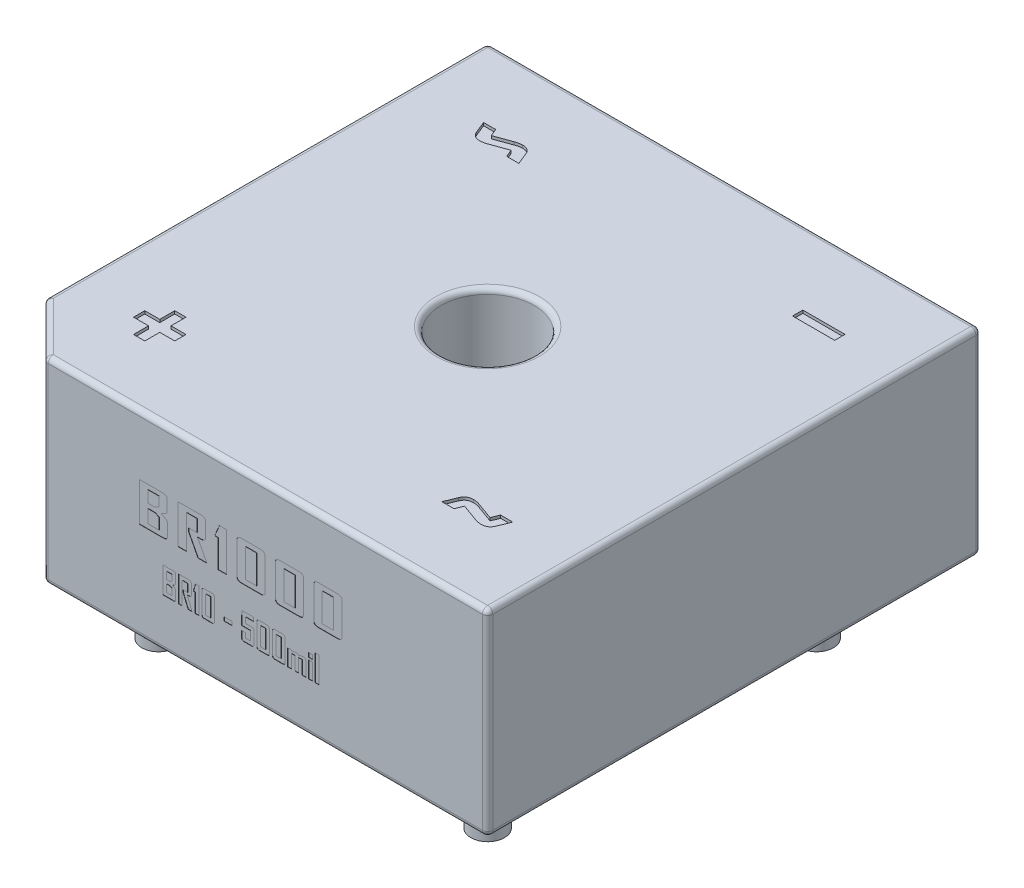
from build123d import *

# Parameters (mm, degrees)
BODY_SKETCH_W          = 19.05
BODY_SKETCH_H          = 19.05
BODY_SKETCH_R          = 1.8
BODY_MAIN_DEPTH        = 7.62
BODY_CHAMFER_SIZE      = 2
SKETCH24_R             = 2.3
BODY_CUT_DEPTH         = 2
BODY_REVOLVE_CUT_REACH = 28.589
BODY_FILLET_R          = 0.2
PIN_B1_SKETCH_R        = 0.65
CIRPATTERN1_COUNT      = 4
TEXT_START             = 3.165
TEXT_2_OUTLINE_W       = 0.43373494
TEXT_2_OUTLINE_H       = 1.102409638
TEXT_2_OUTLINE_W_2     = 0.192771084
TEXT_2_OUTLINE_H_2     = 0.710843374
TEXT_2_OUTLINE_W_3     = 0.144578313
TEXT_2_OUTLINE_H_3     = 1
TEXT_2_OUTLINE_W_4     = 0.144578314
TEXT_2_OUTLINE_H_4     = 0.638554217
TEXT_2_OUTLINE_W_5     = 0.30120482
TEXT_2_OUTLINE_H_5     = 0.144578314
TEXT_2_OUTLINE_W_6     = 0.147213856
TEXT_2_OUTLINE_H_6     = 0.156626506
TEXT_2_DEPTH           = 0.01
SKETCH23_W             = 1.626506024
SKETCH23_H             = 0.397590362
TEXT1_DEPTH            = 0.11
PIN1_MARK_DEPTH        = 0.04


# Read off the part's stored shape, not the designer's step: text
with BuildPart() as part:
    # BODY_Sketch → BODY_MAIN (new body)
    with BuildSketch(Plane(origin=(0, 0.1, 0), x_dir=(1, 0, 0), z_dir=(0, 1, 0))):
        with Locations((6.35, 6.35)):
            Rectangle(BODY_SKETCH_W, BODY_SKETCH_H)
        with Locations(Location((6.35, 6.35, 0), (0, 0, 270))):
            Circle(BODY_SKETCH_R, mode=Mode.SUBTRACT)
    extrude(amount=BODY_MAIN_DEPTH)

    # BODY_Chamfer
    body_chamfer_edges = [part.edges().sort_by_distance(p)[0] for p in [
        (-3.175, 3.91, 3.175),
    ]]
    chamfer(body_chamfer_edges, length=BODY_CHAMFER_SIZE)

    # Sketch24 → BODY_Cut (cut)
    with BuildSketch(Plane(origin=(0, 0.1, 0), x_dir=(1, 0, 0), z_dir=(0, 1, 0))):
        Polygon((-0.760786438, -2.175), (14.875, -2.175), (14.875, 14.875), (-2.175, 14.875), (-2.175, -0.760786438), align=None)
        with Locations(Location((6.35, 6.35, 0), (0, 0, 270))):
            Circle(SKETCH24_R, mode=Mode.SUBTRACT)
    extrude(amount=BODY_CUT_DEPTH, mode=Mode.SUBTRACT)

    # Sketch26 → BODY_Revolve (revolve)
    with BuildSketch(Plane(origin=(0, 0, 0), x_dir=(0, -1, 0), z_dir=(0.7071067811865459, 0, 0.7071067811865493)), mode=Mode.PRIVATE) as body_revolve_sk:
        with BuildLine():
            Line((-0.4, 21.03642674), (-2.3, 21.03642674))
            Line((-2.3, 21.03642674), (-2.3, 11.280256121))
            Line((-2.3, 11.280256121), (-0.4, 11.280256121))
            add(Edge.make_bspline(
                [(-0.4, 21.03642674), (-0.4, 19.889627326), (-0.209776082, 15.127894517), (-3.178684892, 11.698140496), (-0.4, 11.280256121)],
                knots=[0, 0, 0, 0, 0.561002495, 1, 1, 1, 1], degree=3))
        make_face()
    revolve(body_revolve_sk.sketch.rotate(Axis((6.35, 11.869169558, -6.35), (0, -1, 0)), 135), axis=Axis((6.35, 11.869169558, -6.35), (0, -1, 0)))

    # Sketch28 → BODY_Revolve_Cut (cut, up to next)
    with BuildSketch(Plane(origin=(0, 2.3, 0), x_dir=(1, 0, 0), z_dir=(0, 1, 0)), mode=Mode.PRIVATE) as body_revolve_cut_sk1:
        with BuildLine():
            Line((-3.175, -1.040915031), (-3.175, 13.740915031))
            ThreePointArc((-3.175, 13.740915031), (-5.706170619, 6.35), (-3.175, -1.040915031))
        make_face()
    body_revolve_cut_tool1 = extrude(body_revolve_cut_sk1.sketch, amount=-BODY_REVOLVE_CUT_REACH, mode=Mode.PRIVATE) & part.part
    # Sketch28 → BODY_Revolve_Cut (cut, up to next)
    with BuildSketch(Plane(origin=(0, 2.3, 0), x_dir=(1, 0, 0), z_dir=(0, 1, 0)), mode=Mode.PRIVATE) as body_revolve_cut_sk2:
        with BuildLine():
            Line((15.875, 13.740915031), (15.875, -1.040915031))
            ThreePointArc((15.875, -1.040915031), (18.406170619, 6.35), (15.875, 13.740915031))
        make_face()
    body_revolve_cut_tool2 = extrude(body_revolve_cut_sk2.sketch, amount=-BODY_REVOLVE_CUT_REACH, mode=Mode.PRIVATE) & part.part
    # Sketch28 → BODY_Revolve_Cut (cut, up to next)
    with BuildSketch(Plane(origin=(0, 2.3, 0), x_dir=(1, 0, 0), z_dir=(0, 1, 0)), mode=Mode.PRIVATE) as body_revolve_cut_sk3:
        with BuildLine():
            Line((13.740915031, -3.175), (-1.040915031, -3.175))
            ThreePointArc((-1.040915031, -3.175), (6.35, -5.706170619), (13.740915031, -3.175))
        make_face()
    body_revolve_cut_tool3 = extrude(body_revolve_cut_sk3.sketch, amount=-BODY_REVOLVE_CUT_REACH, mode=Mode.PRIVATE) & part.part
    # Sketch28 → BODY_Revolve_Cut (cut, up to next)
    with BuildSketch(Plane(origin=(0, 2.3, 0), x_dir=(1, 0, 0), z_dir=(0, 1, 0)), mode=Mode.PRIVATE) as body_revolve_cut_sk4:
        with BuildLine():
            ThreePointArc((13.740915031, 15.875), (6.35, 18.406170619), (-1.040915031, 15.875))
            Line((-1.040915031, 15.875), (13.740915031, 15.875))
        make_face()
    body_revolve_cut_tool4 = extrude(body_revolve_cut_sk4.sketch, amount=-BODY_REVOLVE_CUT_REACH, mode=Mode.PRIVATE) & part.part
    add(body_revolve_cut_tool1.solids().sort_by_distance((-4.19717, 2.3, -6.35))[0], mode=Mode.SUBTRACT)
    add(body_revolve_cut_tool2.solids().sort_by_distance((16.89717, 2.3, -6.35))[0], mode=Mode.SUBTRACT)
    add(body_revolve_cut_tool3.solids().sort_by_distance((6.35, 2.3, 4.19717))[0], mode=Mode.SUBTRACT)
    add(body_revolve_cut_tool4.solids().sort_by_distance((6.35, 2.3, -16.89717))[0], mode=Mode.SUBTRACT)

    # BODY_Fillet
    body_fillet_edges = [part.edges().sort_by_distance(p)[0] for p in [
        (6.35, 7.72, -8.15),
        (15.875, 7.72, -6.35),
        (6.35, 7.72, -15.875),
        (7.35, 0.1, 3.175),
        (7.35, 7.72, 3.175),
        (-1.175, 3.91, 3.175),
        (-2.175, 0.1, 2.175),
        (-3.175, 3.91, 1.175),
        (-2.175, 7.72, 2.175),
        (-3.175, 7.72, -7.35),
        (6.35, 0.1, -15.875),
        (15.875, 0.1, -6.35),
        (-3.175, 0.1, -7.35),
        (-3.175, 3.91, -15.875),
        (15.875, 3.91, -15.875),
        (15.875, 3.91, 3.175),
    ]]
    fillet(body_fillet_edges, radius=BODY_FILLET_R)

    # PIN_Sweep: sweep along a path in PIN_B1_Path
    with BuildLine(Plane(origin=(0, 0, 0), x_dir=(0, 0, -1), z_dir=(1, 0, 0))) as pin_sweep_path:
        Line((0, -2.7), (0, 0))
        Line((0, 0), (0, 3.91))
    # PIN_B1_Sketch → PIN_Sweep (sweep)
    with BuildSketch(Plane(origin=(0, 0, 0), x_dir=(1, 0, 0), z_dir=(0, 1, 0))):
        Circle(PIN_B1_SKETCH_R)
    pin_sweep = sweep(path=pin_sweep_path.line)

    # CirPattern1: PIN_Sweep ×4 about axis
    cirpattern1_axis = Axis((6.35, 0, -6.35), (0, 1, 0))
    for i in range(1, CIRPATTERN1_COUNT):
        add(pin_sweep.rotate(cirpattern1_axis, i * 360 / CIRPATTERN1_COUNT))

    # text 2 outline → text 2 (cut)
    # profile 1 of 18: a face of its own
    with BuildSketch(Plane.XY.offset(TEXT_START)):
        with BuildLine():
            add(Edge.make_bspline(
                [(3.517168675, 4.028317018), (3.516403883, 4.019278365), (3.514937013, 4.001942231), (3.505322383, 3.977990262), (3.491015138, 3.957239819), (3.470614139, 3.940744985), (3.445590839, 3.927265222), (3.415160578, 3.91805875), (3.379796517, 3.911839387), (3.354454307, 3.910639002), (3.340963855, 3.91)],
                knots=[0, 0, 0, 0, 0.114098337, 0.218840581, 0.322174175, 0.429434412, 0.547100708, 0.679564678, 0.829422238, 1, 1, 1, 1], degree=3))
            Line((3.517168675, 4.028317018), (3.517168675, 4.465440512))
            add(Edge.make_bspline(
                [(3.442338102, 4.602394578), (3.448288657, 4.598208998), (3.459964348, 4.589996395), (3.475118385, 4.575533806), (3.488123987, 4.560008652), (3.498818426, 4.543448906), (3.507290136, 4.525645952), (3.512674186, 4.50652504), (3.516661579, 4.486406256), (3.516997419, 4.472521049), (3.517168675, 4.465440512)],
                knots=[0, 0, 0, 0, 0.133657493, 0.26225178, 0.383948145, 0.505447312, 0.623949121, 0.745003415, 0.869968602, 1, 1, 1, 1], degree=3))
            add(Edge.make_bspline(
                [(3.267262801, 4.687108434), (3.280257347, 4.681000971), (3.304568919, 4.669574485), (3.338522228, 4.653423057), (3.367595791, 4.639562103), (3.391962136, 4.628060985), (3.411403236, 4.618458496), (3.426052825, 4.611058465), (3.435979806, 4.606218917), (3.440746737, 4.603351741), (3.442338102, 4.602394578)],
                knots=[0, 0, 0, 0, 0.221438922, 0.414291367, 0.579869792, 0.718174277, 0.829838972, 0.91423528, 0.971368777, 1, 1, 1, 1], degree=3))
            add(Edge.make_bspline(
                [(3.436408133, 4.768433735), (3.434816301, 4.767477586), (3.430228435, 4.764721841), (3.420754722, 4.76001016), (3.406502054, 4.753328397), (3.387880519, 4.743865854), (3.364120956, 4.73304747), (3.336126554, 4.719368019), (3.303271363, 4.70384559), (3.27978812, 4.692930333), (3.267262801, 4.687108434)],
                knots=[0, 0, 0, 0, 0.029670315, 0.085513729, 0.168947239, 0.28130074, 0.41925825, 0.586125272, 0.779250554, 1, 1, 1, 1], degree=3))
            add(Edge.make_bspline(
                [(3.505873494, 4.899175452), (3.505637137, 4.892295185), (3.505178082, 4.878932312), (3.502167335, 4.8594097), (3.496354084, 4.841271222), (3.488717573, 4.82419458), (3.479041006, 4.808185101), (3.467113672, 4.793429042), (3.452811598, 4.779996723), (3.441967817, 4.77235282), (3.436408133, 4.768433735)],
                knots=[0, 0, 0, 0, 0.133406508, 0.259102454, 0.381455931, 0.501515548, 0.621060989, 0.743032877, 0.868251092, 1, 1, 1, 1], degree=3))
            Line((3.505873494, 4.899175452), (3.505873494, 5.291682982))
            add(Edge.make_bspline(
                [(3.335316265, 5.41), (3.348337796, 5.409360983), (3.372841008, 5.408158516), (3.407069601, 5.40190675), (3.436604499, 5.392759111), (3.460808674, 5.379164858), (3.480630869, 5.36273941), (3.494300253, 5.341895781), (3.503587924, 5.318010235), (3.505089223, 5.300716923), (3.505873494, 5.291682982)],
                knots=[0, 0, 0, 0, 0.168128508, 0.316375143, 0.448176834, 0.565139626, 0.672821552, 0.776962353, 0.883486227, 1, 1, 1, 1], degree=3))
            Line((3.335316265, 5.41), (2.432831325, 5.41))
            Line((2.432831325, 5.41), (2.432831325, 3.91))
            Line((2.432831325, 3.91), (3.340963855, 3.91))
        make_face()
        Polygon((2.75813253, 4.090722892), (2.75813253, 4.596746988), (3.025828313, 4.596746988), (3.19186747, 4.523045934), (3.19186747, 4.090722892), align=None, mode=Mode.SUBTRACT)
        Polygon((3.180572289, 4.856253765), (3.020180723, 4.77746988), (2.75813253, 4.77746988), (2.75813253, 5.229277108), (3.180572289, 5.229277108), align=None, mode=Mode.SUBTRACT)
    # profile 2 of 18: a face of its own
    with BuildSketch(Plane.XY.offset(TEXT_START)):
        with BuildLine():
            add(Edge.make_bspline(
                [(10.249096386, 4.028317018), (10.248331594, 4.019278365), (10.246864724, 4.001942231), (10.237250094, 3.977990262), (10.222942849, 3.957239819), (10.20254185, 3.940744985), (10.17751855, 3.927265222), (10.147088289, 3.91805875), (10.111724227, 3.911839387), (10.086382018, 3.910639002), (10.072891566, 3.91)],
                knots=[0, 0, 0, 0, 0.114098337, 0.218840581, 0.322174175, 0.429434412, 0.547100708, 0.679564678, 0.829422238, 1, 1, 1, 1], degree=3))
            Line((10.249096386, 4.028317018), (10.249096386, 5.291682982))
            add(Edge.make_bspline(
                [(10.072891566, 5.41), (10.086382018, 5.409360998), (10.111724227, 5.408160613), (10.147088289, 5.40194125), (10.17751855, 5.392734778), (10.20254185, 5.379255015), (10.222942849, 5.362760181), (10.237250094, 5.342009738), (10.246864724, 5.318057769), (10.248331594, 5.300721635), (10.249096386, 5.291682982)],
                knots=[0, 0, 0, 0, 0.170577762, 0.320435322, 0.452899292, 0.570565588, 0.677825825, 0.781159419, 0.885901663, 1, 1, 1, 1], degree=3))
            Line((10.072891566, 5.41), (9.345199548, 5.41))
            add(Edge.make_bspline(
                [(9.164759036, 5.291682982), (9.165498227, 5.300731136), (9.166918835, 5.318120262), (9.176927814, 5.342024646), (9.191505894, 5.362874026), (9.212496005, 5.379244688), (9.238049779, 5.392729829), (9.269212496, 5.402009226), (9.305437795, 5.408121642), (9.331429188, 5.409349484), (9.345199548, 5.41)],
                knots=[0, 0, 0, 0, 0.112348161, 0.215915455, 0.318343111, 0.425762474, 0.543690884, 0.676356302, 0.828532073, 1, 1, 1, 1], degree=3))
            Line((9.164759036, 5.291682982), (9.164759036, 4.028317018))
            add(Edge.make_bspline(
                [(9.340963855, 3.91), (9.327473403, 3.910639002), (9.302131194, 3.911839387), (9.266767132, 3.91805875), (9.236336872, 3.927265222), (9.211313572, 3.940744985), (9.190912573, 3.957239819), (9.176605328, 3.977990262), (9.166990697, 4.001942231), (9.165523828, 4.019278365), (9.164759036, 4.028317018)],
                knots=[0, 0, 0, 0, 0.170577762, 0.320435322, 0.452899292, 0.570565588, 0.677825825, 0.781159419, 0.885901663, 1, 1, 1, 1], degree=3))
            Line((9.340963855, 3.91), (10.072891566, 3.91))
        make_face()
        with Locations((9.706927711, 4.66)):
            Rectangle(TEXT_2_OUTLINE_W, TEXT_2_OUTLINE_H, mode=Mode.SUBTRACT)
    # profile 3 of 18: a face of its own
    with BuildSketch(Plane.XY.offset(TEXT_START)):
        with BuildLine():
            add(Edge.make_bspline(
                [(3.831927711, 2.083878012), (3.831502413, 2.077885605), (3.830699122, 2.066567306), (3.826436952, 2.050788213), (3.820183026, 2.037065602), (3.810963007, 2.025964704), (3.799862109, 2.016744684), (3.786139498, 2.010490759), (3.770360405, 2.006228589), (3.759042106, 2.005425298), (3.753049699, 2.005)],
                knots=[0, 0, 0, 0, 0.143087679, 0.270260174, 0.38817721, 0.5, 0.61182279, 0.729739826, 0.856912321, 1, 1, 1, 1], degree=3))
            Line((3.831927711, 2.083878012), (3.831927711, 2.363245482))
            add(Edge.make_bspline(
                [(3.798606928, 2.454548193), (3.803722035, 2.448658419), (3.814045936, 2.436770995), (3.824563304, 2.414859827), (3.830902474, 2.390022305), (3.831575327, 2.372448922), (3.831927711, 2.363245482)],
                knots=[0, 0, 0, 0, 0.233880582, 0.472044868, 0.723502121, 1, 1, 1, 1], degree=3))
            add(Edge.make_bspline(
                [(3.721046687, 2.511024096), (3.726822169, 2.50694868), (3.737633999, 2.49931941), (3.752708036, 2.488607842), (3.765520512, 2.47931161), (3.776323576, 2.471631347), (3.784931784, 2.465219876), (3.791480129, 2.460361372), (3.795900034, 2.457070977), (3.797924165, 2.455184517), (3.798606928, 2.454548193)],
                knots=[0, 0, 0, 0, 0.220969595, 0.413659948, 0.578075155, 0.71580951, 0.828017936, 0.913546243, 0.970838158, 1, 1, 1, 1], degree=3))
            add(Edge.make_bspline(
                [(3.796159639, 2.565240964), (3.795480129, 2.564600396), (3.793493315, 2.562727444), (3.789106795, 2.559745561), (3.782810736, 2.555140383), (3.77467384, 2.548824153), (3.763952872, 2.541718835), (3.751659749, 2.532448222), (3.736965803, 2.522283934), (3.726561506, 2.514924814), (3.721046687, 2.511024096)],
                knots=[0, 0, 0, 0, 0.030202642, 0.08830924, 0.171209504, 0.28295023, 0.421594497, 0.587395026, 0.781297856, 1, 1, 1, 1], degree=3))
            add(Edge.make_bspline(
                [(3.82684488, 2.652402108), (3.826552541, 2.643510421), (3.825995862, 2.626578628), (3.819928261, 2.602821691), (3.810603299, 2.581824722), (3.800907891, 2.570692759), (3.796159639, 2.565240964)],
                knots=[0, 0, 0, 0, 0.28088772, 0.534874023, 0.772208062, 1, 1, 1, 1], degree=3))
            Line((3.82684488, 2.652402108), (3.82684488, 2.926121988))
            add(Edge.make_bspline(
                [(3.750414157, 3.005), (3.75621656, 3.004567036), (3.767221199, 3.00374589), (3.782539409, 2.999560369), (3.79577047, 2.993184364), (3.806493552, 2.984033749), (3.815234626, 2.972804639), (3.821615553, 2.959257878), (3.82554281, 2.943394033), (3.82639373, 2.932106512), (3.82684488, 2.926121988)],
                knots=[0, 0, 0, 0, 0.140866031, 0.267161677, 0.382887924, 0.494174249, 0.60591769, 0.725745796, 0.854593311, 1, 1, 1, 1], degree=3))
            Line((3.750414157, 3.005), (3.337951807, 3.005))
            Line((3.337951807, 3.005), (3.337951807, 2.005))
            Line((3.337951807, 2.005), (3.753049699, 2.005))
        make_face()
        Polygon((3.48253012, 2.149578313), (3.48253012, 2.43873494), (3.612989458, 2.43873494), (3.687349398, 2.396566265), (3.687349398, 2.149578313), align=None, mode=Mode.SUBTRACT)
        Polygon((3.682266566, 2.631694277), (3.610542169, 2.583313253), (3.48253012, 2.583313253), (3.48253012, 2.860421687), (3.682266566, 2.860421687), align=None, mode=Mode.SUBTRACT)
    # profile 4 of 18: a face of its own
    with BuildSketch(Plane.XY.offset(TEXT_START)):
        with BuildLine():
            add(Edge.make_bspline(
                [(4.355459337, 3.005), (4.361636497, 3.004568328), (4.373319355, 3.003751906), (4.389573015, 2.999586876), (4.403555801, 2.993236219), (4.414878141, 2.984157024), (4.423880575, 2.972893549), (4.430063462, 2.959253025), (4.433611412, 2.943368198), (4.434085605, 2.932102717), (4.434337349, 2.926121988)],
                knots=[0, 0, 0, 0, 0.14634727, 0.276786508, 0.395078095, 0.5071419, 0.617118303, 0.733434305, 0.858482998, 1, 1, 1, 1], degree=3))
            Line((4.355459337, 3.005), (3.940361446, 3.005))
            Line((3.940361446, 3.005), (3.940361446, 2.005))
            Line((3.940361446, 2.005), (4.084939759, 2.005))
            Line((4.084939759, 2.005), (4.084939759, 2.860421687))
            Line((4.084939759, 2.860421687), (4.289759036, 2.860421687))
            Line((4.289759036, 2.860421687), (4.289759036, 2.559216867))
            Line((4.289759036, 2.559216867), (4.121084337, 2.559216867))
            Line((4.121084337, 2.559216867), (4.121084337, 2.469231928))
            Line((4.121084337, 2.469231928), (4.313855422, 2.005))
            Line((4.313855422, 2.005), (4.458433735, 2.005))
            Line((4.458433735, 2.005), (4.285052711, 2.462831325))
            add(Edge.make_bspline(
                [(4.388591867, 2.471114458), (4.386278417, 2.470452137), (4.381135762, 2.468979838), (4.372434165, 2.467399801), (4.362024157, 2.465831183), (4.349882573, 2.464849741), (4.33608352, 2.463823455), (4.320571778, 2.463361137), (4.303378042, 2.462964225), (4.291328141, 2.462876836), (4.285052711, 2.462831325)],
                knots=[0, 0, 0, 0, 0.069269872, 0.153982571, 0.254430838, 0.37240564, 0.504648634, 0.652947489, 0.819259615, 1, 1, 1, 1], degree=3))
            add(Edge.make_bspline(
                [(4.434337349, 2.541709337), (4.434188688, 2.537559037), (4.433902878, 2.529579879), (4.431831943, 2.518089461), (4.428246924, 2.507594265), (4.423135279, 2.498131654), (4.416602648, 2.489656203), (4.408632152, 2.482313383), (4.399230559, 2.47596746), (4.392222513, 2.472770633), (4.388591867, 2.471114458)],
                knots=[0, 0, 0, 0, 0.138433635, 0.26614554, 0.387972954, 0.506942436, 0.623360746, 0.743357427, 0.867041637, 1, 1, 1, 1], degree=3))
            Line((4.434337349, 2.541709337), (4.434337349, 2.926121988))
        make_face()
    # profile 5 of 18: a face of its own
    with BuildSketch(Plane.XY.offset(TEXT_START)):
        with BuildLine():
            add(Edge.make_bspline(
                [(8.765361446, 4.028317018), (8.764596654, 4.019278365), (8.763129784, 4.001942231), (8.753515154, 3.977990262), (8.739207909, 3.957239819), (8.71880691, 3.940744985), (8.69378361, 3.927265222), (8.66335335, 3.91805875), (8.627989288, 3.911839387), (8.602647079, 3.910639002), (8.589156627, 3.91)],
                knots=[0, 0, 0, 0, 0.114098337, 0.218840581, 0.322174175, 0.429434412, 0.547100708, 0.679564678, 0.829422238, 1, 1, 1, 1], degree=3))
            Line((8.765361446, 4.028317018), (8.765361446, 5.291682982))
            add(Edge.make_bspline(
                [(8.589156627, 5.41), (8.602647079, 5.409360998), (8.627989288, 5.408160613), (8.66335335, 5.40194125), (8.69378361, 5.392734778), (8.71880691, 5.379255015), (8.739207909, 5.362760181), (8.753515154, 5.342009738), (8.763129784, 5.318057769), (8.764596654, 5.300721635), (8.765361446, 5.291682982)],
                knots=[0, 0, 0, 0, 0.170577762, 0.320435322, 0.452899292, 0.570565588, 0.677825825, 0.781159419, 0.885901663, 1, 1, 1, 1], degree=3))
            Line((8.589156627, 5.41), (7.861464608, 5.41))
            add(Edge.make_bspline(
                [(7.681024096, 5.291682982), (7.681763287, 5.300731136), (7.683183895, 5.318120262), (7.693192875, 5.342024646), (7.707770954, 5.362874026), (7.728761065, 5.379244688), (7.754314839, 5.392729829), (7.785477556, 5.402009226), (7.821702855, 5.408121642), (7.847694248, 5.409349484), (7.861464608, 5.41)],
                knots=[0, 0, 0, 0, 0.112348161, 0.215915455, 0.318343111, 0.425762474, 0.543690884, 0.676356302, 0.828532073, 1, 1, 1, 1], degree=3))
            Line((7.681024096, 5.291682982), (7.681024096, 4.028317018))
            add(Edge.make_bspline(
                [(7.857228916, 3.91), (7.843738464, 3.910639002), (7.818396254, 3.911839387), (7.783032193, 3.91805875), (7.752601932, 3.927265222), (7.727578632, 3.940744985), (7.707177633, 3.957239819), (7.692870388, 3.977990262), (7.683255758, 4.001942231), (7.681788888, 4.019278365), (7.681024096, 4.028317018)],
                knots=[0, 0, 0, 0, 0.170577762, 0.320435322, 0.452899292, 0.570565588, 0.677825825, 0.781159419, 0.885901663, 1, 1, 1, 1], degree=3))
            Line((7.857228916, 3.91), (8.589156627, 3.91))
        make_face()
        with Locations((8.223192771, 4.66)):
            Rectangle(TEXT_2_OUTLINE_W, TEXT_2_OUTLINE_H, mode=Mode.SUBTRACT)
    # profile 6 of 18: a face of its own
    with BuildSketch(Plane.XY.offset(TEXT_START)):
        with BuildLine():
            add(Edge.make_bspline(
                [(7.281626506, 4.028317018), (7.280861715, 4.019278365), (7.279394845, 4.001942231), (7.269780214, 3.977990262), (7.255472969, 3.957239819), (7.235071971, 3.940744985), (7.21004867, 3.927265222), (7.17961841, 3.91805875), (7.144254348, 3.911839387), (7.118912139, 3.910639002), (7.105421687, 3.91)],
                knots=[0, 0, 0, 0, 0.114098337, 0.218840581, 0.322174175, 0.429434412, 0.547100708, 0.679564678, 0.829422238, 1, 1, 1, 1], degree=3))
            Line((7.281626506, 4.028317018), (7.281626506, 5.291682982))
            add(Edge.make_bspline(
                [(7.105421687, 5.41), (7.118912139, 5.409360998), (7.144254348, 5.408160613), (7.17961841, 5.40194125), (7.21004867, 5.392734778), (7.235071971, 5.379255015), (7.255472969, 5.362760181), (7.269780214, 5.342009738), (7.279394845, 5.318057769), (7.280861715, 5.300721635), (7.281626506, 5.291682982)],
                knots=[0, 0, 0, 0, 0.170577762, 0.320435322, 0.452899292, 0.570565588, 0.677825825, 0.781159419, 0.885901663, 1, 1, 1, 1], degree=3))
            Line((7.105421687, 5.41), (6.377729669, 5.41))
            add(Edge.make_bspline(
                [(6.197289157, 5.291682982), (6.198028347, 5.300731136), (6.199448956, 5.318120262), (6.209457935, 5.342024646), (6.224036014, 5.362874026), (6.245026125, 5.379244688), (6.270579899, 5.392729829), (6.301742617, 5.402009226), (6.337967915, 5.408121642), (6.363959308, 5.409349484), (6.377729669, 5.41)],
                knots=[0, 0, 0, 0, 0.112348161, 0.215915455, 0.318343111, 0.425762474, 0.543690884, 0.676356302, 0.828532073, 1, 1, 1, 1], degree=3))
            Line((6.197289157, 5.291682982), (6.197289157, 4.028317018))
            add(Edge.make_bspline(
                [(6.373493976, 3.91), (6.360003524, 3.910639002), (6.334661315, 3.911839387), (6.299297253, 3.91805875), (6.268866993, 3.927265222), (6.243843692, 3.940744985), (6.223442693, 3.957239819), (6.209135448, 3.977990262), (6.199520818, 4.001942231), (6.198053948, 4.019278365), (6.197289157, 4.028317018)],
                knots=[0, 0, 0, 0, 0.170577762, 0.320435322, 0.452899292, 0.570565588, 0.677825825, 0.781159419, 0.885901663, 1, 1, 1, 1], degree=3))
            Line((6.373493976, 3.91), (7.105421687, 3.91))
        make_face()
        with Locations((6.739457831, 4.66)):
            Rectangle(TEXT_2_OUTLINE_W, TEXT_2_OUTLINE_H, mode=Mode.SUBTRACT)
    # profile 7 of 18: a face of its own
    with BuildSketch(Plane.XY.offset(TEXT_START)):
        with BuildLine():
            add(Edge.make_bspline(
                [(4.806626506, 5.41), (4.820396407, 5.409353242), (4.846294209, 5.40813685), (4.882346298, 5.402024216), (4.913192008, 5.392695934), (4.938470455, 5.379425436), (4.958628546, 5.362710413), (4.972802839, 5.342101933), (4.981390184, 5.317923264), (4.982336176, 5.300698659), (4.982831325, 5.291682982)],
                knots=[0, 0, 0, 0, 0.173100919, 0.325560326, 0.45836141, 0.576368255, 0.682086324, 0.784127399, 0.887008277, 1, 1, 1, 1], degree=3))
            Line((4.806626506, 5.41), (3.916566265, 5.41))
            Line((3.916566265, 5.41), (3.916566265, 3.91))
            Line((3.916566265, 3.91), (4.24186747, 3.91))
            Line((4.24186747, 3.91), (4.24186747, 5.211204819))
            Line((4.24186747, 5.211204819), (4.65753012, 5.211204819))
            Line((4.65753012, 5.211204819), (4.65753012, 4.741325301))
            Line((4.65753012, 4.741325301), (4.332228916, 4.741325301))
            Line((4.332228916, 4.741325301), (4.332228916, 4.606347892))
            Line((4.332228916, 4.606347892), (4.693674699, 3.91))
            Line((4.693674699, 3.91), (5.037048193, 3.91))
            Line((5.037048193, 3.91), (4.674755271, 4.596746988))
            add(Edge.make_bspline(
                [(4.888516566, 4.609171687), (4.883725199, 4.608178437), (4.873066714, 4.605968936), (4.855138862, 4.603580787), (4.833681887, 4.601258847), (4.808612849, 4.599761124), (4.780098026, 4.598239929), (4.748082046, 4.597542832), (4.712596356, 4.596944426), (4.687745088, 4.596814763), (4.674755271, 4.596746988)],
                knots=[0, 0, 0, 0, 0.068435704, 0.152236465, 0.252866326, 0.370327714, 0.503487578, 0.652338624, 0.818276565, 1, 1, 1, 1], degree=3))
            add(Edge.make_bspline(
                [(4.982831325, 4.715064006), (4.982612232, 4.70881782), (4.982187591, 4.696711646), (4.977382569, 4.679426615), (4.97002771, 4.663526015), (4.959368258, 4.649415702), (4.946027763, 4.636586795), (4.929494656, 4.625734768), (4.910077864, 4.616379382), (4.89592074, 4.611646817), (4.888516566, 4.609171687)],
                knots=[0, 0, 0, 0, 0.12182148, 0.236110828, 0.348079567, 0.46256141, 0.579719413, 0.708357487, 0.847471012, 1, 1, 1, 1], degree=3))
            Line((4.982831325, 4.715064006), (4.982831325, 5.291682982))
        make_face()
    # profile 8 of 18: a face of its own
    with BuildSketch(Plane.XY.offset(TEXT_START)):
        with BuildLine():
            add(Edge.make_bspline(
                [(5.325903614, 2.083878012), (5.325478317, 2.077885605), (5.324675026, 2.066567306), (5.320412855, 2.050788213), (5.31415893, 2.037065602), (5.304938911, 2.025964704), (5.293838013, 2.016744684), (5.280115402, 2.010490759), (5.264336309, 2.006228589), (5.25301801, 2.005425298), (5.247025602, 2.005)],
                knots=[0, 0, 0, 0, 0.143087679, 0.270260174, 0.38817721, 0.5, 0.61182279, 0.729739826, 0.856912321, 1, 1, 1, 1], degree=3))
            Line((5.325903614, 2.083878012), (5.325903614, 2.926121988))
            add(Edge.make_bspline(
                [(5.247025602, 3.005), (5.25301801, 3.004574702), (5.264336309, 3.003771411), (5.280115402, 2.999509241), (5.293838013, 2.993255316), (5.304938911, 2.984035296), (5.31415893, 2.972934398), (5.320412855, 2.959211787), (5.324675026, 2.943432694), (5.325478317, 2.932114395), (5.325903614, 2.926121988)],
                knots=[0, 0, 0, 0, 0.143087679, 0.270260174, 0.38817721, 0.5, 0.61182279, 0.729739826, 0.856912321, 1, 1, 1, 1], degree=3))
            Line((5.247025602, 3.005), (4.924924699, 3.005))
            add(Edge.make_bspline(
                [(4.843975904, 2.926121988), (4.844384212, 2.932117466), (4.845156544, 2.943458173), (4.849650865, 2.959240236), (4.856131224, 2.972876024), (4.865326025, 2.984169706), (4.87684021, 2.993241146), (4.890952403, 2.999549964), (4.907189725, 3.003741356), (4.918810017, 3.004566044), (4.924924699, 3.005)],
                knots=[0, 0, 0, 0, 0.141191735, 0.267070268, 0.384070853, 0.494411966, 0.607065164, 0.726092805, 0.855868051, 1, 1, 1, 1], degree=3))
            Line((4.843975904, 2.926121988), (4.843975904, 2.083878012))
            add(Edge.make_bspline(
                [(4.922853916, 2.005), (4.916861508, 2.005425298), (4.90554321, 2.006228589), (4.889764116, 2.010490759), (4.876041505, 2.016744684), (4.864940607, 2.025964704), (4.855720588, 2.037065602), (4.849466663, 2.050788213), (4.845204493, 2.066567306), (4.844401201, 2.077885605), (4.843975904, 2.083878012)],
                knots=[0, 0, 0, 0, 0.143087679, 0.270260174, 0.38817721, 0.5, 0.61182279, 0.729739826, 0.856912321, 1, 1, 1, 1], degree=3))
            Line((4.922853916, 2.005), (5.247025602, 2.005))
        make_face()
        with Locations((5.084939759, 2.505)):
            Rectangle(TEXT_2_OUTLINE_W_2, TEXT_2_OUTLINE_H_2, mode=Mode.SUBTRACT)
    # profile 9 of 18: a face of its own
    with BuildSketch(Plane.XY.offset(TEXT_START)):
        with BuildLine():
            add(Edge.make_bspline(
                [(6.856024096, 2.083878012), (6.855598799, 2.077885605), (6.854795507, 2.066567306), (6.850533337, 2.050788213), (6.844279412, 2.037065602), (6.835059393, 2.025964704), (6.823958495, 2.016744684), (6.810235884, 2.010490759), (6.79445679, 2.006228589), (6.783138492, 2.005425298), (6.777146084, 2.005)],
                knots=[0, 0, 0, 0, 0.143087679, 0.270260174, 0.38817721, 0.5, 0.61182279, 0.729739826, 0.856912321, 1, 1, 1, 1], degree=3))
            Line((6.856024096, 2.083878012), (6.856024096, 2.564676205))
            add(Edge.make_bspline(
                [(6.777146084, 2.643554217), (6.783138492, 2.643128919), (6.79445679, 2.642325628), (6.810235884, 2.638063458), (6.823958495, 2.631809533), (6.835059393, 2.622589513), (6.844279412, 2.611488615), (6.850533337, 2.597766004), (6.854795507, 2.581986911), (6.855598799, 2.570668612), (6.856024096, 2.564676205)],
                knots=[0, 0, 0, 0, 0.143087679, 0.270260174, 0.38817721, 0.5, 0.61182279, 0.729739826, 0.856912321, 1, 1, 1, 1], degree=3))
            Line((6.777146084, 2.643554217), (6.518674699, 2.643554217))
            Line((6.518674699, 2.643554217), (6.530722892, 2.860421687))
            Line((6.530722892, 2.860421687), (6.843975904, 2.860421687))
            Line((6.843975904, 2.860421687), (6.843975904, 3.005))
            Line((6.843975904, 3.005), (6.386144578, 3.005))
            Line((6.386144578, 3.005), (6.374096386, 2.498975904))
            Line((6.374096386, 2.498975904), (6.711445783, 2.498975904))
            Line((6.711445783, 2.498975904), (6.711445783, 2.149578313))
            Line((6.711445783, 2.149578313), (6.518674699, 2.149578313))
            Line((6.518674699, 2.149578313), (6.518674699, 2.330301205))
            Line((6.518674699, 2.330301205), (6.374096386, 2.330301205))
            Line((6.374096386, 2.330301205), (6.374096386, 2.083878012))
            add(Edge.make_bspline(
                [(6.452974398, 2.005), (6.44698199, 2.005425298), (6.435663691, 2.006228589), (6.419884598, 2.010490759), (6.406161987, 2.016744684), (6.395061089, 2.025964704), (6.38584107, 2.037065602), (6.379587145, 2.050788213), (6.375324974, 2.066567306), (6.374521683, 2.077885605), (6.374096386, 2.083878012)],
                knots=[0, 0, 0, 0, 0.143087679, 0.270260174, 0.38817721, 0.5, 0.61182279, 0.729739826, 0.856912321, 1, 1, 1, 1], degree=3))
            Line((6.452974398, 2.005), (6.777146084, 2.005))
        make_face()
    # profile 10 of 18: a face of its own
    with BuildSketch(Plane.XY.offset(TEXT_START)):
        with BuildLine():
            add(Edge.make_bspline(
                [(7.446385542, 2.083878012), (7.445960244, 2.077885605), (7.445156953, 2.066567306), (7.440894783, 2.050788213), (7.434640858, 2.037065602), (7.425420838, 2.025964704), (7.41431994, 2.016744684), (7.400597329, 2.010490759), (7.384818236, 2.006228589), (7.373499938, 2.005425298), (7.36750753, 2.005)],
                knots=[0, 0, 0, 0, 0.143087679, 0.270260174, 0.38817721, 0.5, 0.61182279, 0.729739826, 0.856912321, 1, 1, 1, 1], degree=3))
            Line((7.446385542, 2.083878012), (7.446385542, 2.926121988))
            add(Edge.make_bspline(
                [(7.36750753, 3.005), (7.373499938, 3.004574702), (7.384818236, 3.003771411), (7.400597329, 2.999509241), (7.41431994, 2.993255316), (7.425420838, 2.984035296), (7.434640858, 2.972934398), (7.440894783, 2.959211787), (7.445156953, 2.943432694), (7.445960244, 2.932114395), (7.446385542, 2.926121988)],
                knots=[0, 0, 0, 0, 0.143087679, 0.270260174, 0.38817721, 0.5, 0.61182279, 0.729739826, 0.856912321, 1, 1, 1, 1], degree=3))
            Line((7.36750753, 3.005), (7.045406627, 3.005))
            add(Edge.make_bspline(
                [(6.964457831, 2.926121988), (6.96486614, 2.932117466), (6.965638472, 2.943458173), (6.970132792, 2.959240236), (6.976613152, 2.972876024), (6.985807953, 2.984169706), (6.997322138, 2.993241146), (7.01143433, 2.999549964), (7.027671652, 3.003741356), (7.039291945, 3.004566044), (7.045406627, 3.005)],
                knots=[0, 0, 0, 0, 0.141191735, 0.267070268, 0.384070853, 0.494411966, 0.607065164, 0.726092805, 0.855868051, 1, 1, 1, 1], degree=3))
            Line((6.964457831, 2.926121988), (6.964457831, 2.083878012))
            add(Edge.make_bspline(
                [(7.043335843, 2.005), (7.037343436, 2.005425298), (7.026025137, 2.006228589), (7.010246044, 2.010490759), (6.996523433, 2.016744684), (6.985422535, 2.025964704), (6.976202516, 2.037065602), (6.96994859, 2.050788213), (6.96568642, 2.066567306), (6.964883129, 2.077885605), (6.964457831, 2.083878012)],
                knots=[0, 0, 0, 0, 0.143087679, 0.270260174, 0.38817721, 0.5, 0.61182279, 0.729739826, 0.856912321, 1, 1, 1, 1], degree=3))
            Line((7.043335843, 2.005), (7.36750753, 2.005))
        make_face()
        with Locations((7.205421687, 2.505)):
            Rectangle(TEXT_2_OUTLINE_W_2, TEXT_2_OUTLINE_H_2, mode=Mode.SUBTRACT)
    # profile 11 of 18: a face of its own
    with BuildSketch(Plane.XY.offset(TEXT_START)):
        with BuildLine():
            add(Edge.make_bspline(
                [(8.048795181, 2.083878012), (8.048369883, 2.077885605), (8.047566592, 2.066567306), (8.043304422, 2.050788213), (8.037050496, 2.037065602), (8.027830477, 2.025964704), (8.016729579, 2.016744684), (8.003006968, 2.010490759), (7.987227875, 2.006228589), (7.975909576, 2.005425298), (7.969917169, 2.005)],
                knots=[0, 0, 0, 0, 0.143087679, 0.270260174, 0.38817721, 0.5, 0.61182279, 0.729739826, 0.856912321, 1, 1, 1, 1], degree=3))
            Line((8.048795181, 2.083878012), (8.048795181, 2.926121988))
            add(Edge.make_bspline(
                [(7.969917169, 3.005), (7.975909576, 3.004574702), (7.987227875, 3.003771411), (8.003006968, 2.999509241), (8.016729579, 2.993255316), (8.027830477, 2.984035296), (8.037050496, 2.972934398), (8.043304422, 2.959211787), (8.047566592, 2.943432694), (8.048369883, 2.932114395), (8.048795181, 2.926121988)],
                knots=[0, 0, 0, 0, 0.143087679, 0.270260174, 0.38817721, 0.5, 0.61182279, 0.729739826, 0.856912321, 1, 1, 1, 1], degree=3))
            Line((7.969917169, 3.005), (7.647816265, 3.005))
            add(Edge.make_bspline(
                [(7.56686747, 2.926121988), (7.567275778, 2.932117466), (7.568048111, 2.943458173), (7.572542431, 2.959240236), (7.57902279, 2.972876024), (7.588217591, 2.984169706), (7.599731777, 2.993241146), (7.613843969, 2.999549964), (7.630081291, 3.003741356), (7.641701583, 3.004566044), (7.647816265, 3.005)],
                knots=[0, 0, 0, 0, 0.141191735, 0.267070268, 0.384070853, 0.494411966, 0.607065164, 0.726092805, 0.855868051, 1, 1, 1, 1], degree=3))
            Line((7.56686747, 2.926121988), (7.56686747, 2.083878012))
            add(Edge.make_bspline(
                [(7.645745482, 2.005), (7.639753074, 2.005425298), (7.628434776, 2.006228589), (7.612655683, 2.010490759), (7.598933072, 2.016744684), (7.587832174, 2.025964704), (7.578612154, 2.037065602), (7.572358229, 2.050788213), (7.568096059, 2.066567306), (7.567292768, 2.077885605), (7.56686747, 2.083878012)],
                knots=[0, 0, 0, 0, 0.143087679, 0.270260174, 0.38817721, 0.5, 0.61182279, 0.729739826, 0.856912321, 1, 1, 1, 1], degree=3))
            Line((7.645745482, 2.005), (7.969917169, 2.005))
        make_face()
        with Locations((7.807831325, 2.505)):
            Rectangle(TEXT_2_OUTLINE_W_2, TEXT_2_OUTLINE_H_2, mode=Mode.SUBTRACT)
    # profile 12 of 18: a face of its own
    with BuildSketch(Plane.XY.offset(TEXT_START)):
        with BuildLine():
            add(Edge.make_bspline(
                [(8.301807229, 2.610421687), (8.317809462, 2.613932438), (8.349754067, 2.620940808), (8.381689979, 2.627988688), (8.397628012, 2.631506024)],
                knots=[0, 0, 0, 0, 0.500936953, 1, 1, 1, 1], degree=3))
            Line((8.301807229, 2.610421687), (8.301807229, 2.643554217))
            Line((8.301807229, 2.643554217), (8.157228916, 2.643554217))
            Line((8.157228916, 2.643554217), (8.157228916, 2.005))
            Line((8.157228916, 2.005), (8.301807229, 2.005))
            Line((8.301807229, 2.005), (8.301807229, 2.521566265))
            Line((8.301807229, 2.521566265), (8.434337349, 2.523072289))
            Line((8.434337349, 2.523072289), (8.434337349, 2.005))
            Line((8.434337349, 2.005), (8.578915663, 2.005))
            Line((8.578915663, 2.005), (8.578915663, 2.521566265))
            Line((8.578915663, 2.521566265), (8.711445783, 2.523072289))
            Line((8.711445783, 2.523072289), (8.711445783, 2.005))
            Line((8.711445783, 2.005), (8.856024096, 2.005))
            Line((8.856024096, 2.005), (8.856024096, 2.564676205))
            add(Edge.make_bspline(
                [(8.771686747, 2.643554217), (8.778171375, 2.643253553), (8.790456914, 2.642683926), (8.807641935, 2.638781632), (8.822295014, 2.632318334), (8.834497012, 2.623570007), (8.844082774, 2.612203183), (8.850829974, 2.598369843), (8.854971632, 2.582224643), (8.855661248, 2.570726215), (8.856024096, 2.564676205)],
                knots=[0, 0, 0, 0, 0.148290832, 0.280946377, 0.400455298, 0.512425211, 0.621411208, 0.736958176, 0.861597969, 1, 1, 1, 1], degree=3))
            add(Edge.make_bspline(
                [(8.667959337, 2.629246988), (8.6785511, 2.631389603), (8.698426199, 2.63541015), (8.726354522, 2.63996172), (8.750356102, 2.642819783), (8.765029309, 2.643324995), (8.771686747, 2.643554217)],
                knots=[0, 0, 0, 0, 0.309141697, 0.580094407, 0.809483008, 1, 1, 1, 1], degree=3))
            add(Edge.make_bspline(
                [(8.565549699, 2.607786145), (8.582624261, 2.61127019), (8.616798606, 2.618243426), (8.650897372, 2.62557733), (8.667959337, 2.629246988)],
                knots=[0, 0, 0, 0, 0.499630991, 1, 1, 1, 1], degree=3))
            add(Edge.make_bspline(
                [(8.494578313, 2.643554217), (8.498977599, 2.643459163), (8.507372771, 2.643277772), (8.51936308, 2.641549379), (8.530156093, 2.638828311), (8.53966396, 2.634777842), (8.548195663, 2.629920693), (8.555296484, 2.623630731), (8.561439619, 2.616367551), (8.564161901, 2.610683717), (8.565549699, 2.607786145)],
                knots=[0, 0, 0, 0, 0.156270314, 0.29821119, 0.429671568, 0.550627586, 0.664617534, 0.776870433, 0.88625033, 1, 1, 1, 1], degree=3))
            add(Edge.make_bspline(
                [(8.397628012, 2.631506024), (8.40690072, 2.633346616), (8.424635825, 2.636866955), (8.450143577, 2.640578016), (8.473194654, 2.6430487), (8.487733157, 2.643392395), (8.494578313, 2.643554217)],
                knots=[0, 0, 0, 0, 0.289803378, 0.554281819, 0.790142707, 1, 1, 1, 1], degree=3))
        make_face()
    # profile 13 of 18: a face of its own
    with BuildSketch(Plane.XY.offset(TEXT_START)):
        Polygon((5.472590361, 3.91), (5.797891566, 3.91), (5.797891566, 5.41), (5.516641566, 5.41), (5.346084337, 5.003373494), (5.346084337, 4.97626506), (5.472590361, 4.97626506), align=None)
    # profile 14 of 18: a face of its own
    with BuildSketch(Plane.XY.offset(TEXT_START)):
        with Locations((9.289759037, 2.505)):
            Rectangle(TEXT_2_OUTLINE_W_3, TEXT_2_OUTLINE_H_3)
    # profile 15 of 18: a face of its own
    with BuildSketch(Plane.XY.offset(TEXT_START)):
        Polygon((4.578915663, 2.005), (4.723493976, 2.005), (4.723493976, 3.005), (4.598682229, 3.005), (4.518674699, 2.733915663), (4.518674699, 2.715843373), (4.578915663, 2.715843373), align=None)
    # profile 16 of 18: a face of its own
    with BuildSketch(Plane.XY.offset(TEXT_START)):
        with Locations((9.036746988, 2.324277109)):
            Rectangle(TEXT_2_OUTLINE_W_4, TEXT_2_OUTLINE_H_4)
    # profile 17 of 18: a face of its own
    with BuildSketch(Plane.XY.offset(TEXT_START)):
        with Locations((5.85, 2.378493976)):
            Rectangle(TEXT_2_OUTLINE_W_5, TEXT_2_OUTLINE_H_5)
    # profile 18 of 18: a face of its own
    with BuildSketch(Plane.XY.offset(TEXT_START)):
        with Locations((9.036746988, 2.806204819)):
            Rectangle(TEXT_2_OUTLINE_W_6, TEXT_2_OUTLINE_H_6)
    extrude(amount=TEXT_2_DEPTH, mode=Mode.SUBTRACT)

    # Sketch23 → text1 (cut)
    with BuildSketch(Plane(origin=(0, 7.72, 0), x_dir=(1, 0, 0), z_dir=(0, 1, 0))):
        Polygon((0.795180723, -0.175038369), (0.21686747, -0.175038369), (0.21686747, -0.753351622), (-0.21686747, -0.753351622), (-0.21686747, -0.175038369), (-0.795180723, -0.175038369), (-0.795180723, 0.258696571), (-0.21686747, 0.258696571), (-0.21686747, 0.837009824), (0.21686747, 0.837009824), (0.21686747, 0.258696571), (0.795180723, 0.258696571), align=None)
        with Locations((12.7, 12.784676923)):
            Rectangle(SKETCH23_W, SKETCH23_H)
        with BuildLine():
            add(Edge.make_bspline(
                [(1.314194277, 12.864307947), (1.306266347, 12.882295586), (1.290827293, 12.917325175), (1.259100321, 12.963852966), (1.223087398, 13.004302884), (1.180298569, 13.036126877), (1.132867832, 13.061260411), (1.08033177, 13.079372183), (1.022477731, 13.090301181), (0.982166168, 13.091357148), (0.96121988, 13.091905839)],
                knots=[0, 0, 0, 0, 1.047552543, 2.040030669, 2.993409779, 3.92621919, 4.870493698, 5.849596395, 6.882628907, 8, 8, 8, 8], degree=3))
            add(Edge.make_bspline(
                [(0.96121988, 13.091905839), (0.940099522, 13.091205595), (0.896502189, 13.08976013), (0.829370309, 13.078970701), (0.759019462, 13.061409652), (0.711679838, 13.045377018), (0.687311747, 13.037124212)],
                knots=[0, 0, 0, 0, 0.902830916, 1.863653174, 2.900314585, 4, 4, 4, 4], degree=3))
            Line((0.687311747, 13.037124212), (0.038403614, 12.802749212))
            Line((0.038403614, 12.802749212), (-0.079066265, 13.091905839))
            Line((-0.079066265, 13.091905839), (-0.548945783, 13.091905839))
            Line((-0.548945783, 13.091905839), (-0.361445783, 12.629368188))
            add(Edge.make_bspline(
                [(-0.361445783, 12.629368188), (-0.353502538, 12.611581311), (-0.338031752, 12.576938421), (-0.30658195, 12.530873238), (-0.269958306, 12.49186081), (-0.228244564, 12.459536049), (-0.180450287, 12.435141729), (-0.127472199, 12.417837387), (-0.069171302, 12.406722161), (-0.028479752, 12.405693306), (-0.007341867, 12.405158851)],
                knots=[0, 0, 0, 0, 1.040915043, 2.027354414, 2.968181752, 3.895150658, 4.836948532, 5.824621982, 6.869964711, 8, 8, 8, 8], degree=3))
            add(Edge.make_bspline(
                [(-0.007341867, 12.405158851), (0.013024986, 12.405871031), (0.055309017, 12.407349602), (0.1205777, 12.418078411), (0.189699899, 12.435943821), (0.236540292, 12.451726356), (0.260918675, 12.459940477)],
                knots=[0, 0, 0, 0, 0.888322291, 1.844263648, 2.878033235, 4, 4, 4, 4], degree=3))
            Line((0.260918675, 12.459940477), (0.913215361, 12.694315477))
            Line((0.913215361, 12.694315477), (1.030685241, 12.405158851))
            Line((1.030685241, 12.405158851), (1.500564759, 12.405158851))
            Line((1.500564759, 12.405158851), (1.314194277, 12.864307947))
        make_face()
        with BuildLine():
            add(Edge.make_bspline(
                [(13.188893072, -0.164307947), (13.180965142, -0.182295586), (13.165526088, -0.217325175), (13.133799116, -0.263852966), (13.097786193, -0.304302884), (13.054997364, -0.336126877), (13.007566627, -0.361260411), (12.955030565, -0.379372183), (12.897176526, -0.390301181), (12.856864963, -0.391357148), (12.835918675, -0.391905839)],
                knots=[0, 0, 0, 0, 1.047552543, 2.040030669, 2.993409779, 3.92621919, 4.870493698, 5.849596395, 6.882628907, 8, 8, 8, 8], degree=3))
            add(Edge.make_bspline(
                [(12.835918675, -0.391905839), (12.814798318, -0.391205595), (12.771200984, -0.38976013), (12.704069104, -0.378970701), (12.633718257, -0.361409652), (12.586378633, -0.345377018), (12.562010542, -0.337124212)],
                knots=[0, 0, 0, 0, 0.902830916, 1.863653174, 2.900314585, 4, 4, 4, 4], degree=3))
            Line((12.562010542, -0.337124212), (11.91310241, -0.102749212))
            Line((11.91310241, -0.102749212), (11.79563253, -0.391905839))
            Line((11.79563253, -0.391905839), (11.325753012, -0.391905839))
            Line((11.325753012, -0.391905839), (11.513253012, 0.070631812))
            add(Edge.make_bspline(
                [(11.513253012, 0.070631812), (11.521196257, 0.088418689), (11.536667043, 0.123061579), (11.568116846, 0.169126762), (11.60474049, 0.20813919), (11.646454231, 0.240463951), (11.694248508, 0.264858271), (11.747226596, 0.282162613), (11.805527493, 0.293277839), (11.846219044, 0.294306694), (11.867356928, 0.294841149)],
                knots=[0, 0, 0, 0, 1.040915043, 2.027354414, 2.968181752, 3.895150658, 4.836948532, 5.824621982, 6.869964711, 8, 8, 8, 8], degree=3))
            add(Edge.make_bspline(
                [(11.867356928, 0.294841149), (11.887723781, 0.294128969), (11.930007812, 0.292650398), (11.995276495, 0.281921589), (12.064398694, 0.264056179), (12.111239088, 0.248273644), (12.13561747, 0.240059523)],
                knots=[0, 0, 0, 0, 0.888322291, 1.844263648, 2.878033235, 4, 4, 4, 4], degree=3))
            Line((12.13561747, 0.240059523), (12.787914157, 0.005684523))
            Line((12.787914157, 0.005684523), (12.905384036, 0.294841149))
            Line((12.905384036, 0.294841149), (13.375263554, 0.294841149))
            Line((13.375263554, 0.294841149), (13.188893072, -0.164307947))
        make_face()
    extrude(amount=-TEXT1_DEPTH, mode=Mode.SUBTRACT)

    # Sketch16 → pin1_mark (cut)
    with BuildSketch(Plane(origin=(-2.175, 5.37112392, 2.175), x_dir=(0.49999999999999883, -0.7071067811865483, 0.4999999999999999), z_dir=(0.7071067811865483, 0, -0.7071067811865468))):
        Polygon((2.607888452, 3.220260888), (3.220260888, 2.607888452), (3.444404756, 3.444404756), align=None)
        Polygon((1.390139395, 0.602429205), (1.125079154, 0.866359928), (1.389009877, 1.131420169), (1.172142407, 1.347534627), (0.908211684, 1.082474386), (0.643151443, 1.346781615), (0.451133371, 1.154010531), (0.716193612, 0.889703302), (0.451886383, 0.624643061), (0.668753853, 0.408528603), (0.933061082, 0.673588844), (1.198121323, 0.409658121), align=None)
    extrude(amount=PIN1_MARK_DEPTH, mode=Mode.SUBTRACT)


solid = part.part
